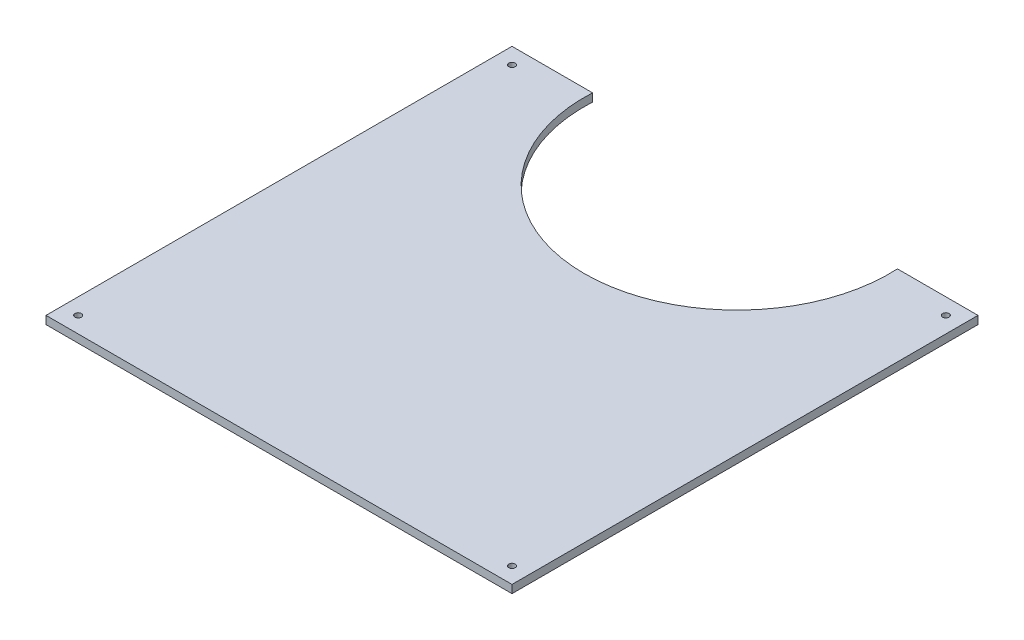
from build123d import *

# Parameters (mm, degrees)
BOSS_EXTRU_1_DEPTH      = 5
ESQUISSE3_R             = 2
ENL_V_MAT_EXTRU_1_DEPTH = 10


with BuildPart() as part:
    # Esquisse2 → Boss.-Extru.1 (new body)
    with BuildSketch(Plane(origin=(0, 0, 0), x_dir=(1, 0, 0), z_dir=(0, 1, 0))):
        with BuildLine():
            Line((0, 0), (290, 0))
            Line((290, 0), (290, 290))
            Line((290, 290), (239.868329805, 290))
            ThreePointArc((239.868329805, 290), (145, 190), (50.131670195, 290))
            Line((50.131670195, 290), (0, 290))
            Line((0, 290), (0, 0))
        make_face()
    extrude(amount=BOSS_EXTRU_1_DEPTH)

    # Esquisse3 → Enlèv. mat.-Extru.1 (cut)
    with BuildSketch(Plane(origin=(0, 5, 0), x_dir=(1, 0, 0), z_dir=(0, 1, 0))):
        with Locations((10, 280)):
            Circle(ESQUISSE3_R)
        with Locations((280, 280)):
            Circle(ESQUISSE3_R)
        with Locations((280, 10)):
            Circle(ESQUISSE3_R)
        with Locations((10, 10)):
            Circle(ESQUISSE3_R)
    extrude(amount=-ENL_V_MAT_EXTRU_1_DEPTH, mode=Mode.SUBTRACT)


solid = part.part
